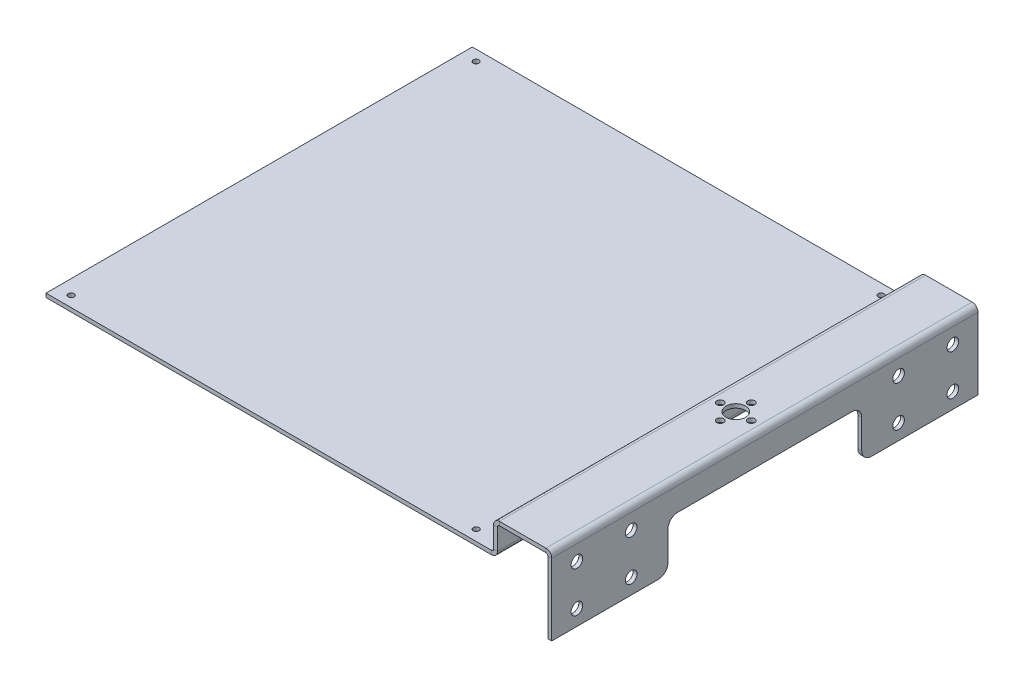
from build123d import *

# Parameters (mm, degrees)
BASE_FLANGE1_DEPTH = 220
SKETCH6_R          = 1.8
CUT_EXTRUDE1_DEPTH = 343.171009877
SKETCH7_R          = 1.5
CUT_EXTRUDE2_DEPTH = 341.743305143
SKETCH8_R          = 3
CUT_EXTRUDE3_DEPTH = 2
SKETCH10_W         = 100
SKETCH10_H         = 25
CUT_EXTRUDE8_DEPTH = 2
FILLET1_R          = 5
SKETCH11_R         = 5.05
CUT_EXTRUDE9_DEPTH = 2


# Sheet-metal steps are written as plain solids
with BuildPart() as part:
    # Sketch1 → Base-Flange1 (new body)
    with BuildSketch(Plane.XY):
        with BuildLine():
            Line((0, 0), (0, 37))
            ThreePointArc((0, 37), (-0.292893219, 37.707106781), (-1, 38))
            Line((-1, 38), (-25, 38))
            ThreePointArc((-25, 38), (-25.707106781, 37.707106781), (-26, 37))
            Line((-26, 37), (-26, 26))
            ThreePointArc((-26, 26), (-26.878679656, 23.878679656), (-29, 23))
            Line((-29, 23), (-259, 23))
            Line((-259, 23), (-259, 25))
            Line((-259, 25), (-29, 25))
            ThreePointArc((-29, 25), (-28.292893219, 25.292893219), (-28, 26))
            Line((-28, 26), (-28, 37))
            ThreePointArc((-28, 37), (-27.121320344, 39.121320344), (-25, 40))
            Line((-25, 40), (-1, 40))
            ThreePointArc((-1, 40), (1.121320344, 39.121320344), (2, 37))
            Line((2, 37), (2, 0))
            Line((2, 0), (0, 0))
        make_face()
    extrude(amount=BASE_FLANGE1_DEPTH)

    # Sketch6 → Cut-Extrude1 (cut, through all)
    with BuildSketch(Plane(origin=(0, 40, 0), x_dir=(1, 0, 0), z_dir=(0, 1, 0))):
        with Locations(Location((-21, -110, 0), (0, 0, 180))):
            Circle(SKETCH6_R)
        with Locations(Location((-5, -110, 0), (0, 0, 90))):
            Circle(SKETCH6_R)
        with Locations(Location((-13, -118, 0), (0, 0, 180))):
            Circle(SKETCH6_R)
        with Locations(Location((-13, -102, 0), (0, 0, 90))):
            Circle(SKETCH6_R)
    extrude(amount=-CUT_EXTRUDE1_DEPTH, mode=Mode.SUBTRACT)

    # Sketch7 → Cut-Extrude2 (cut, through all)
    with BuildSketch(Plane(origin=(0, 25, 0), x_dir=(1, 0, 0), z_dir=(0, 1, 0))):
        with Locations(Location((-42.5, -5.5, 0), (0, 0, 180))):
            Circle(SKETCH7_R)
        with Locations((-251.5, -5.5)):
            Circle(SKETCH7_R)
        with Locations(Location((-251.5, -214.5, 0), (0, 0, 180))):
            Circle(SKETCH7_R)
        with Locations((-42.5, -214.5)):
            Circle(SKETCH7_R)
    extrude(amount=-CUT_EXTRUDE2_DEPTH, mode=Mode.SUBTRACT)

    # Sketch8 → Cut-Extrude3 (cut)
    with BuildSketch(Plane(origin=(2, 0, 0), x_dir=(0, 0, -1), z_dir=(1, 0, 0))):
        with Locations((-207, 8)):
            Circle(SKETCH8_R)
        with Locations((-207, 29)):
            Circle(SKETCH8_R)
        with Locations(Location((-179, 29, 0), (0, 0, 180))):
            Circle(SKETCH8_R)
        with Locations(Location((-179, 8, 0), (0, 0, 180))):
            Circle(SKETCH8_R)
        with Locations((-41, 8)):
            Circle(SKETCH8_R)
        with Locations((-41, 29)):
            Circle(SKETCH8_R)
        with Locations(Location((-13, 29, 0), (0, 0, 180))):
            Circle(SKETCH8_R)
        with Locations(Location((-13, 8, 0), (0, 0, 180))):
            Circle(SKETCH8_R)
    extrude(amount=-CUT_EXTRUDE3_DEPTH, mode=Mode.SUBTRACT)

    # Sketch10 → Cut-Extrude8 (cut)
    with BuildSketch(Plane(origin=(2, 0, 0), x_dir=(0, 0, -1), z_dir=(1, 0, 0))):
        with Locations((-110, 12.5)):
            Rectangle(SKETCH10_W, SKETCH10_H)
    extrude(amount=-CUT_EXTRUDE8_DEPTH, mode=Mode.SUBTRACT)

    # Fillet1
    fillet1_edges = [part.edges().sort_by_distance(p)[0] for p in [
        (1, 0, 60),
        (1, 0, 160),
        (1, 25, 160),
        (1, 25, 60),
    ]]
    fillet(fillet1_edges, radius=FILLET1_R)

    # Sketch11 → Cut-Extrude9 (cut)
    with BuildSketch(Plane(origin=(0, 40, 0), x_dir=(1, 0, 0), z_dir=(0, 1, 0))):
        with Locations(Location((-13, -110, 0), (0, 0, 270))):
            Circle(SKETCH11_R)
    extrude(amount=-CUT_EXTRUDE9_DEPTH, mode=Mode.SUBTRACT)


solid = part.part
